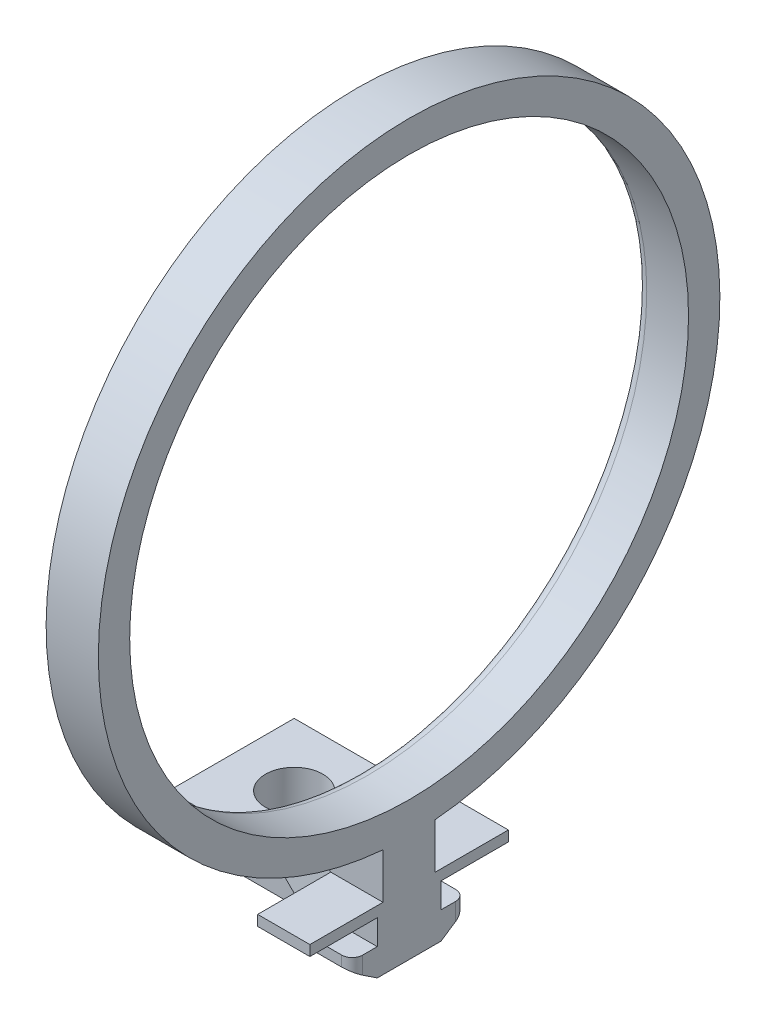
from build123d import *

# Parameters (mm, degrees)
SKETCH1_R            = 29.75
SKETCH1_R_2          = 26.75
BOSS_EXTRUDE1_DEPTH  = 5
SKETCH2_W            = 5
SKETCH2_H            = 5.355228117
BOSS_EXTRUDE2_DEPTH  = 5
BOSS_EXTRUDE3_DEPTH  = 5
FILLET1_R            = 1
SKETCH38_W           = 12
SKETCH38_H           = 3.5
BOSS_EXTRUDE28_DEPTH = 12
CUT_EXTRUDE3_REACH   = 72.183
SKETCH39_R           = 2.75
CHAMFER1_SIZE        = 2.5
FILLET3_R            = 1


with BuildPart() as part:
    # Sketch1 → Boss-Extrude1 (new body)
    with BuildSketch(Plane(origin=(0, 0, 0), x_dir=(0, 0, -1), z_dir=(1, 0, 0))):
        Circle(SKETCH1_R)
        Circle(SKETCH1_R_2, mode=Mode.SUBTRACT)
    extrude(amount=-BOSS_EXTRUDE1_DEPTH)

    # Sketch2 → Boss-Extrude2 (add)
    with BuildSketch(Plane(origin=(0, 0, 0), x_dir=(0, 0, -1), z_dir=(1, 0, 0))):
        with Locations((0, -32.322385942)):
            Rectangle(SKETCH2_W, SKETCH2_H)
    extrude(amount=-BOSS_EXTRUDE2_DEPTH)

    # Sketch3 → Boss-Extrude3 (add)
    with BuildSketch(Plane(origin=(0, 0, 0), x_dir=(0, 0, -1), z_dir=(1, 0, 0))):
        Polygon((-9.5, -35), (-9.5, -34), (9.5, -34), (9.5, -35), (3.05, -35), (3.05, -37.4), (5.45, -37.4), (5.45, -38.4), (3.05, -40), (-3.05, -40), (-5.45, -38.4), (-5.45, -37.4), (-3.05, -37.4), (-3.05, -35), align=None)
    extrude(amount=-BOSS_EXTRUDE3_DEPTH)

    # Fillet1
    fillet1_edges = [part.edges().sort_by_distance(p)[0] for p in [
        (0, -37.9, 5.45),
        (0, -37.9, -5.45),
    ]]
    fillet(fillet1_edges, radius=FILLET1_R)

    # Sketch38 → Boss-Extrude28 (add)
    with BuildSketch(Plane.ZY.offset(5)):
        with Locations((0, -33.25)):
            Rectangle(SKETCH38_W, SKETCH38_H)
    extrude(amount=BOSS_EXTRUDE28_DEPTH)

    # Sketch39 → Cut-Extrude3 (cut, up to next)
    with BuildSketch(Plane(origin=(0, -31.5, 0), x_dir=(1, 0, 0), z_dir=(0, 1, 0)), mode=Mode.PRIVATE) as cut_extrude3_sk1:
        with Locations(Location((-11, 0, 0), (0, 0, 270))):
            Circle(SKETCH39_R)
    cut_extrude3_tool1 = extrude(cut_extrude3_sk1.sketch, amount=-CUT_EXTRUDE3_REACH, mode=Mode.PRIVATE) & part.part
    add(cut_extrude3_tool1.solids().sort_by_distance((-11, -31.5, 0))[0], mode=Mode.SUBTRACT)

    # Chamfer1
    chamfer1_edges = [part.edges().sort_by_distance(p)[0] for p in [
        (-5, -31.5, 4.25),
        (-5, -31.5, -4.25),
    ]]
    chamfer(chamfer1_edges, length=CHAMFER1_SIZE - 0.0001)  # a hair under: the kernel refuses the full size

    # Fillet3
    fillet3_edges = [part.edges().sort_by_distance(p)[0] for p in [
        (-5, 0, 26.75),
    ]]
    fillet(fillet3_edges, radius=FILLET3_R)


solid = part.part
